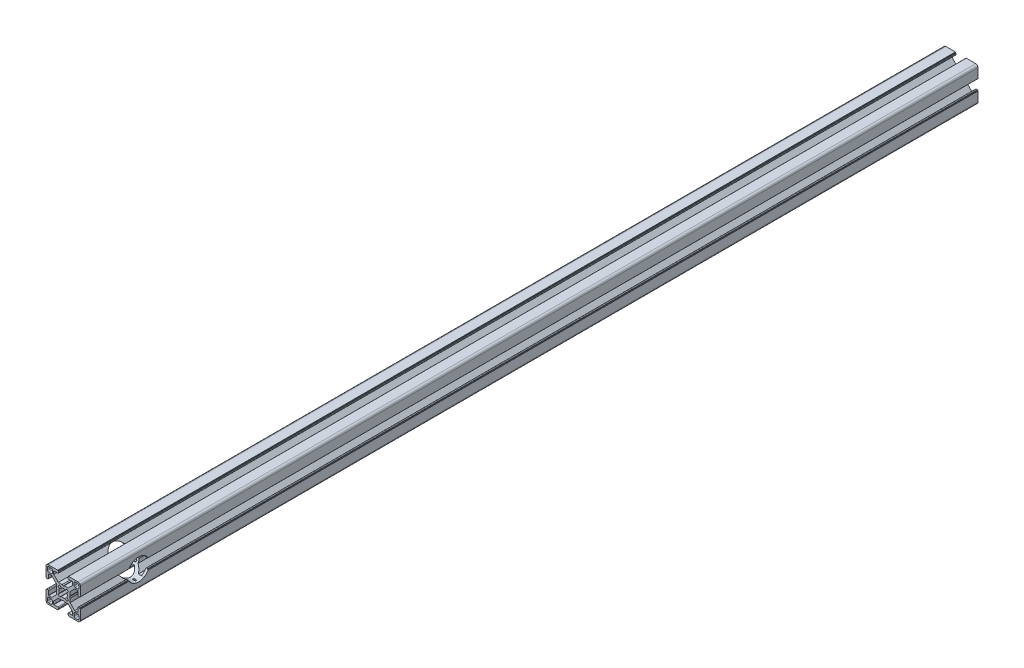
from build123d import *

# Parameters (mm, degrees)
BOSS_EXTRUDE1_DEPTH = 783.59
CUT_EXTRUDE1_REACH  = 786.308
SKETCH3_R           = 9.525


with BuildPart() as part:
    # Sketch1 → Boss-Extrude1 (new body)
    with BuildSketch(Plane.XY):
        with BuildLine():
            Line((6.00446543, 0.899999619), (5.484852164, 0))
            Line((5.484852164, 0), (6.00446543, -0.899999619))
            Line((6.00446543, -0.899999619), (6.00446543, -4.204465866))
            Line((6.00446543, -4.204465866), (10.049999564, -8.25))
            Line((10.049999564, -8.25), (12.59999928, -8.25))
            ThreePointArc((12.59999928, -8.25), (12.741420837, -8.191421273), (12.799999564, -8.049999716))
            Line((12.799999564, -8.049999716), (12.799999564, -4.649999613))
            ThreePointArc((12.799999564, -4.649999613), (12.975735606, -4.225735278), (13.39999994, -4.049999237))
            Line((13.39999994, -4.049999237), (14.300000043, -4.049999237))
            ThreePointArc((14.300000043, -4.049999237), (14.4414216, -4.108577964), (14.500000327, -4.249999521))
            Line((14.500000327, -4.249999521), (14.500000327, -4.349998953))
            ThreePointArc((14.500000327, -4.349998953), (14.558579054, -4.49142051), (14.700000611, -4.549999237))
            Line((14.700000611, -4.549999237), (14.799999716, -4.549999237))
            ThreePointArc((14.799999716, -4.549999237), (14.941421273, -4.608577964), (15, -4.749999521))
            Line((15, -4.749999521), (15, -13.000000346))
            ThreePointArc((15, -13.000000346), (14.414213664, -14.414213664), (13.000000346, -15))
            Line((13.000000346, -15), (4.749999945, -15))
            ThreePointArc((4.749999945, -15), (4.60857832, -14.941421245), (4.549999564, -14.799999619))
            Line((4.549999564, -14.799999619), (4.549999564, -14.69999942))
            ThreePointArc((4.549999564, -14.69999942), (4.49142109, -14.558578474), (4.350000144, -14.5))
            Line((4.350000144, -14.5), (4.250000374, -14.5))
            ThreePointArc((4.250000374, -14.5), (4.108578753, -14.441421247), (4.05, -14.299999626))
            Line((4.05, -14.299999626), (4.05, -13.399999434))
            ThreePointArc((4.05, -13.399999434), (4.225735989, -12.975735226), (4.650000197, -12.799999237))
            Line((4.650000197, -12.799999237), (8.049999924, -12.799999237))
            ThreePointArc((8.049999924, -12.799999237), (8.191421565, -12.741420475), (8.250000327, -12.599998834))
            Line((8.250000327, -12.599998834), (8.250000327, -10.049999237))
            Line((8.250000327, -10.049999237), (4.204466193, -6))
            Line((4.204466193, -6), (0.899999946, -6))
            Line((0.899999946, -6), (0, -5.484851837))
            Line((0, -5.484851837), (-0.899999946, -6))
            Line((-0.899999946, -6), (-4.204466193, -6))
            Line((-4.204466193, -6), (-8.250000327, -10.049999237))
            Line((-8.250000327, -10.049999237), (-8.250000327, -12.599998834))
            ThreePointArc((-8.250000327, -12.599998834), (-8.191421565, -12.741420475), (-8.049999924, -12.799999237))
            Line((-8.049999924, -12.799999237), (-4.650000197, -12.799999237))
            ThreePointArc((-4.650000197, -12.799999237), (-4.225735989, -12.975735226), (-4.05, -13.399999434))
            Line((-4.05, -13.399999434), (-4.05, -14.299999626))
            ThreePointArc((-4.05, -14.299999626), (-4.108578753, -14.441421247), (-4.250000374, -14.5))
            Line((-4.250000374, -14.5), (-4.350000144, -14.5))
            ThreePointArc((-4.350000144, -14.5), (-4.49142109, -14.558578474), (-4.549999564, -14.69999942))
            Line((-4.549999564, -14.69999942), (-4.549999564, -14.799999619))
            ThreePointArc((-4.549999564, -14.799999619), (-4.60857832, -14.941421245), (-4.749999945, -15))
            Line((-4.749999945, -15), (-13.000000346, -15))
            ThreePointArc((-13.000000346, -15), (-14.414213664, -14.414213664), (-15, -13.000000346))
            Line((-15, -13.000000346), (-15, -4.749999521))
            ThreePointArc((-15, -4.749999521), (-14.941421273, -4.608577964), (-14.799999716, -4.549999237))
            Line((-14.799999716, -4.549999237), (-14.700000611, -4.549999237))
            ThreePointArc((-14.700000611, -4.549999237), (-14.558579054, -4.49142051), (-14.500000327, -4.349998953))
            Line((-14.500000327, -4.349998953), (-14.500000327, -4.249999521))
            ThreePointArc((-14.500000327, -4.249999521), (-14.4414216, -4.108577964), (-14.300000043, -4.049999237))
            Line((-14.300000043, -4.049999237), (-13.39999994, -4.049999237))
            ThreePointArc((-13.39999994, -4.049999237), (-12.975735606, -4.225735278), (-12.799999564, -4.649999613))
            Line((-12.799999564, -4.649999613), (-12.799999564, -8.049999716))
            ThreePointArc((-12.799999564, -8.049999716), (-12.741420837, -8.191421273), (-12.59999928, -8.25))
            Line((-12.59999928, -8.25), (-10.049999564, -8.25))
            Line((-10.049999564, -8.25), (-6.00446543, -4.204465866))
            Line((-6.00446543, -4.204465866), (-6.00446543, -0.899999619))
            Line((-6.00446543, -0.899999619), (-5.484852164, 0))
            Line((-5.484852164, 0), (-6.00446543, 0.899999619))
            Line((-6.00446543, 0.899999619), (-6.00446543, 4.204465866))
            Line((-6.00446543, 4.204465866), (-10.049999564, 8.25))
            Line((-10.049999564, 8.25), (-12.59999928, 8.25))
            ThreePointArc((-12.59999928, 8.25), (-12.741420837, 8.191421273), (-12.799999564, 8.049999716))
            Line((-12.799999564, 8.049999716), (-12.799999564, 4.649999613))
            ThreePointArc((-12.799999564, 4.649999613), (-12.975735606, 4.225735278), (-13.39999994, 4.049999237))
            Line((-13.39999994, 4.049999237), (-14.300000043, 4.049999237))
            ThreePointArc((-14.300000043, 4.049999237), (-14.4414216, 4.108577964), (-14.500000327, 4.249999521))
            Line((-14.500000327, 4.249999521), (-14.500000327, 4.349998953))
            ThreePointArc((-14.500000327, 4.349998953), (-14.558579054, 4.49142051), (-14.700000611, 4.549999237))
            Line((-14.700000611, 4.549999237), (-14.799999716, 4.549999237))
            ThreePointArc((-14.799999716, 4.549999237), (-14.941421273, 4.608577964), (-15, 4.749999521))
            Line((-15, 4.749999521), (-15, 13.000000346))
            ThreePointArc((-15, 13.000000346), (-14.414213664, 14.414213664), (-13.000000346, 15))
            Line((-13.000000346, 15), (-4.749999945, 15))
            ThreePointArc((-4.749999945, 15), (-4.60857832, 14.941421245), (-4.549999564, 14.799999619))
            Line((-4.549999564, 14.799999619), (-4.549999564, 14.69999942))
            ThreePointArc((-4.549999564, 14.69999942), (-4.49142109, 14.558578474), (-4.350000144, 14.5))
            Line((-4.350000144, 14.5), (-4.250000374, 14.5))
            ThreePointArc((-4.250000374, 14.5), (-4.108578753, 14.441421247), (-4.05, 14.299999626))
            Line((-4.05, 14.299999626), (-4.05, 13.399999434))
            ThreePointArc((-4.05, 13.399999434), (-4.225735989, 12.975735226), (-4.650000197, 12.799999237))
            Line((-4.650000197, 12.799999237), (-8.049999924, 12.799999237))
            ThreePointArc((-8.049999924, 12.799999237), (-8.191421565, 12.741420475), (-8.250000327, 12.599998834))
            Line((-8.250000327, 12.599998834), (-8.250000327, 10.049999237))
            Line((-8.250000327, 10.049999237), (-4.204466193, 6))
            Line((-4.204466193, 6), (-0.899999946, 6))
            Line((-0.899999946, 6), (0, 5.484851837))
            Line((0, 5.484851837), (0.899999946, 6))
            Line((0.899999946, 6), (4.204466193, 6))
            Line((4.204466193, 6), (8.250000327, 10.049999237))
            Line((8.250000327, 10.049999237), (8.250000327, 12.599998834))
            ThreePointArc((8.250000327, 12.599998834), (8.191421565, 12.741420475), (8.049999924, 12.799999237))
            Line((8.049999924, 12.799999237), (4.650000197, 12.799999237))
            ThreePointArc((4.650000197, 12.799999237), (4.225735989, 12.975735226), (4.05, 13.399999434))
            Line((4.05, 13.399999434), (4.05, 14.299999626))
            ThreePointArc((4.05, 14.299999626), (4.108578753, 14.441421247), (4.250000374, 14.5))
            Line((4.250000374, 14.5), (4.350000144, 14.5))
            ThreePointArc((4.350000144, 14.5), (4.49142109, 14.558578474), (4.549999564, 14.69999942))
            Line((4.549999564, 14.69999942), (4.549999564, 14.799999619))
            ThreePointArc((4.549999564, 14.799999619), (4.60857832, 14.941421245), (4.749999945, 15))
            Line((4.749999945, 15), (13.000000346, 15))
            ThreePointArc((13.000000346, 15), (14.414213664, 14.414213664), (15, 13.000000346))
            Line((15, 13.000000346), (15, 4.749999521))
            ThreePointArc((15, 4.749999521), (14.941421273, 4.608577964), (14.799999716, 4.549999237))
            Line((14.799999716, 4.549999237), (14.700000611, 4.549999237))
            ThreePointArc((14.700000611, 4.549999237), (14.558579054, 4.49142051), (14.500000327, 4.349998953))
            Line((14.500000327, 4.349998953), (14.500000327, 4.249999521))
            ThreePointArc((14.500000327, 4.249999521), (14.4414216, 4.108577964), (14.300000043, 4.049999237))
            Line((14.300000043, 4.049999237), (13.39999994, 4.049999237))
            ThreePointArc((13.39999994, 4.049999237), (12.975735606, 4.225735278), (12.799999564, 4.649999613))
            Line((12.799999564, 4.649999613), (12.799999564, 8.049999716))
            ThreePointArc((12.799999564, 8.049999716), (12.741420837, 8.191421273), (12.59999928, 8.25))
            Line((12.59999928, 8.25), (10.049999564, 8.25))
            Line((10.049999564, 8.25), (6.00446543, 4.204465866))
            Line((6.00446543, 4.204465866), (6.00446543, 0.899999619))
        make_face()
        with BuildLine():
            Line((13.70000109, 12.700000398), (13.70000109, 10.499999635))
            ThreePointArc((13.70000109, 10.499999635), (13.407107874, 9.792892851), (12.70000109, 9.499999635))
            Line((12.70000109, 9.499999635), (10.500000327, 9.499999635))
            ThreePointArc((10.500000327, 9.499999635), (9.792893543, 9.792892851), (9.500000327, 10.499999635))
            Line((9.500000327, 10.499999635), (9.500000327, 12.700000398))
            ThreePointArc((9.500000327, 12.700000398), (9.792893543, 13.407107182), (10.500000327, 13.700000398))
            Line((10.500000327, 13.700000398), (12.70000109, 13.700000398))
            ThreePointArc((12.70000109, 13.700000398), (13.407107874, 13.407107182), (13.70000109, 12.700000398))
        make_face(mode=Mode.SUBTRACT)
        with BuildLine():
            Line((3.135929412, 4.518400903), (1.600129524, 3.280561767))
            ThreePointArc((1.600129524, 3.280561767), (0, 3.65), (-1.600129524, 3.280561767))
            Line((-1.600129524, 3.280561767), (-3.135929412, 4.518400903))
            ThreePointArc((-3.135929412, 4.518400903), (-3.881002259, 3.897155561), (-4.505336892, 3.154669473))
            Line((-4.505336892, 3.154669473), (-3.280561732, 1.600129597))
            ThreePointArc((-3.280561732, 1.600129597), (-3.65, 0), (-3.280561732, -1.600129597))
            Line((-3.280561732, -1.600129597), (-4.505336892, -3.154669473))
            ThreePointArc((-4.505336892, -3.154669473), (-3.881002259, -3.897155561), (-3.135929412, -4.518400903))
            Line((-3.135929412, -4.518400903), (-1.600129524, -3.280561767))
            ThreePointArc((-1.600129524, -3.280561767), (0, -3.65), (1.600129524, -3.280561767))
            Line((1.600129524, -3.280561767), (3.135929412, -4.518400903))
            ThreePointArc((3.135929412, -4.518400903), (3.881002259, -3.897155561), (4.505336892, -3.154669473))
            Line((4.505336892, -3.154669473), (3.280561732, -1.600129597))
            ThreePointArc((3.280561732, -1.600129597), (3.65, 0), (3.280561732, 1.600129597))
            Line((3.280561732, 1.600129597), (4.505336892, 3.154669473))
            ThreePointArc((4.505336892, 3.154669473), (3.881002259, 3.897155561), (3.135929412, 4.518400903))
        make_face(mode=Mode.SUBTRACT)
        with BuildLine():
            Line((-13.70000109, -12.700000398), (-13.70000109, -10.499999635))
            ThreePointArc((-13.70000109, -10.499999635), (-13.407107874, -9.792892851), (-12.70000109, -9.499999635))
            Line((-12.70000109, -9.499999635), (-10.500000327, -9.499999635))
            ThreePointArc((-10.500000327, -9.499999635), (-9.792893543, -9.792892851), (-9.500000327, -10.499999635))
            Line((-9.500000327, -10.499999635), (-9.500000327, -12.700000398))
            ThreePointArc((-9.500000327, -12.700000398), (-9.792893543, -13.407107182), (-10.500000327, -13.700000398))
            Line((-10.500000327, -13.700000398), (-12.70000109, -13.700000398))
            ThreePointArc((-12.70000109, -13.700000398), (-13.407107874, -13.407107182), (-13.70000109, -12.700000398))
        make_face(mode=Mode.SUBTRACT)
        with BuildLine():
            Line((10.500000327, -13.700000398), (12.70000109, -13.700000398))
            ThreePointArc((12.70000109, -13.700000398), (13.407107874, -13.407107182), (13.70000109, -12.700000398))
            Line((13.70000109, -12.700000398), (13.70000109, -10.499999635))
            ThreePointArc((13.70000109, -10.499999635), (13.407107874, -9.792892851), (12.70000109, -9.499999635))
            Line((12.70000109, -9.499999635), (10.500000327, -9.499999635))
            ThreePointArc((10.500000327, -9.499999635), (9.792893543, -9.792892851), (9.500000327, -10.499999635))
            Line((9.500000327, -10.499999635), (9.500000327, -12.700000398))
            ThreePointArc((9.500000327, -12.700000398), (9.792893543, -13.407107182), (10.500000327, -13.700000398))
        make_face(mode=Mode.SUBTRACT)
        with BuildLine():
            Line((-10.500000327, 13.700000398), (-12.70000109, 13.700000398))
            ThreePointArc((-12.70000109, 13.700000398), (-13.407107874, 13.407107182), (-13.70000109, 12.700000398))
            Line((-13.70000109, 12.700000398), (-13.70000109, 10.499999635))
            ThreePointArc((-13.70000109, 10.499999635), (-13.407107874, 9.792892851), (-12.70000109, 9.499999635))
            Line((-12.70000109, 9.499999635), (-10.500000327, 9.499999635))
            ThreePointArc((-10.500000327, 9.499999635), (-9.792893543, 9.792892851), (-9.500000327, 10.499999635))
            Line((-9.500000327, 10.499999635), (-9.500000327, 12.700000398))
            ThreePointArc((-9.500000327, 12.700000398), (-9.792893543, 13.407107182), (-10.500000327, 13.700000398))
        make_face(mode=Mode.SUBTRACT)
    extrude(amount=BOSS_EXTRUDE1_DEPTH)

    # Sketch3 → Cut-Extrude1 (cut, up to next)
    with BuildSketch(Plane.ZY.offset(15), mode=Mode.PRIVATE) as cut_extrude1_sk1:
        with Locations((732.79, 0)):
            Circle(SKETCH3_R)
    cut_extrude1_tool1 = extrude(cut_extrude1_sk1.sketch, amount=-CUT_EXTRUDE1_REACH, mode=Mode.PRIVATE) & part.part
    add(cut_extrude1_tool1.solids().sort_by_distance((-15, 0, 732.79))[0], mode=Mode.SUBTRACT)


solid = part.part
